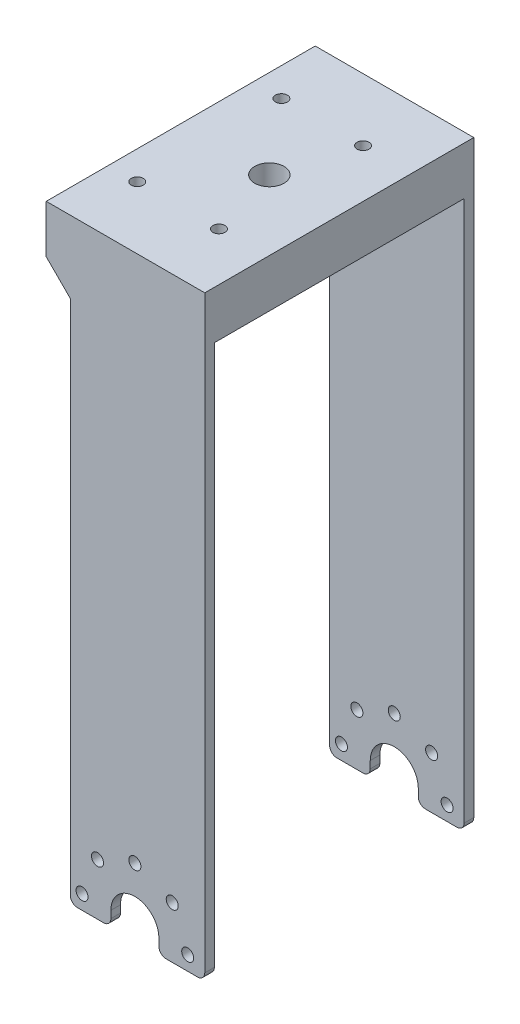
from build123d import *

# Parameters (mm, degrees)
SKETCH1_W               = 28
SKETCH1_H               = 124.1
BOSS_EXTRUDE1_DEPTH     = 2
CUT_EXTRUDE2_DEPTH      = 128.235254548
CUT_EXTRUDE2_DEPTH_BACK = 2
SKETCH4_R               = 1.25
CUT_EXTRUDE3_DEPTH      = 2
CIRPATTERN1_COUNT       = 5
CIRPATTERN1_ANGLE       = 180
FILLET1_R               = 1.5
SKETCH7_W               = 28
SKETCH7_H               = 124.1
BOSS_EXTRUDE2_DEPTH     = 2
CUT_EXTRUDE4_DEPTH      = 139.999316545
CUT_EXTRUDE4_DEPTH_BACK = 2
CUT_EXTRUDE5_START      = -2
SKETCH11_R              = 1.25
CUT_EXTRUDE5_DEPTH      = 2
CIRPATTERN2_COUNT       = 5
CIRPATTERN2_ANGLE       = 180
FILLET2_R               = 1.5
SKETCH17_W              = 33
SKETCH17_H              = 52
BOSS_EXTRUDE5_DEPTH     = 15
CUT_EXTRUDE7_REACH      = 140.999
SKETCH18_R              = 3.05
SKETCH19_R              = 1.25
CUT_EXTRUDE8_DEPTH      = 10
SKETCH20_W              = 29.100039055
SKETCH20_H              = 52
CUT_EXTRUDE9_DEPTH      = 5
SKETCH21_W              = 5
SKETCH21_H              = 15
BOSS_EXTRUDE6_DEPTH     = 2
SKETCH22_W              = 52
SKETCH22_H              = 5
CUT_EXTRUDE10_DEPTH     = 140.645667674
SKETCH23_W              = 52
SKETCH23_H              = 5
CUT_EXTRUDE11_DEPTH     = 140.645676357
CUT_EXTRUDE12_DEPTH     = 139.205680057
SKETCH25_R              = 2.5
CUT_EXTRUDE13_DEPTH     = 5


with BuildPart() as part:
    # Sketch1 → Boss-Extrude1 (new body)
    with BuildSketch(Plane.XY):
        with Locations((14, 62.05)):
            Rectangle(SKETCH1_W, SKETCH1_H)
    extrude(amount=-BOSS_EXTRUDE1_DEPTH)

    # Sketch3 → Cut-Extrude2 (cut, two sides: drawn at the far end of the back side and taken through both)
    with BuildSketch(Plane.XY.offset(-CUT_EXTRUDE2_DEPTH_BACK)):
        with BuildLine():
            Line((18.449960945, -261.260932316), (18.449960945, 0))
            Line((18.449960945, 0), (18.449960945, 3))
            ThreePointArc((18.449960945, 3), (13.449960945, 8), (8.449960945, 3))
            Line((8.449960945, 3), (8.449960945, 0))
            Line((8.449960945, 0), (8.449960945, -261.260932316))
            Line((8.449960945, -261.260932316), (8.449960945, -783.782796947))
            Line((8.449960945, -783.782796947), (18.449960945, -783.782796947))
            Line((18.449960945, -783.782796947), (18.449960945, -261.260932316))
        make_face()
    extrude(amount=CUT_EXTRUDE2_DEPTH + CUT_EXTRUDE2_DEPTH_BACK, mode=Mode.SUBTRACT)

    # Sketch4 → Cut-Extrude3 (cut)
    with BuildSketch(Plane.XY):
        with Locations((2.449960945, 3)):
            Circle(SKETCH4_R)
    cut_extrude3 = extrude(amount=-CUT_EXTRUDE3_DEPTH, mode=Mode.SUBTRACT)

    # CirPattern1: Cut-Extrude3 ×5 about axis
    cirpattern1_axis = Axis((13.449960945, 3, 0), (0, 0, -1))
    for i in range(1, CIRPATTERN1_COUNT):
        add(cut_extrude3.rotate(cirpattern1_axis, i * CIRPATTERN1_ANGLE / (CIRPATTERN1_COUNT - 1)), mode=Mode.SUBTRACT)

    # Fillet1
    fillet1_edges = [part.edges().sort_by_distance(p)[0] for p in [
        (28, 0, -1),
        (0, 0, -1),
        (18.449960945, 0, -1),
        (8.449960945, 0, -1),
    ]]
    fillet(fillet1_edges, radius=FILLET1_R)



with BuildPart() as body_2:
    # Sketch7 → Boss-Extrude2 (new body)
    with BuildSketch(Plane.XY.offset(-56)):
        with Locations((14, 62.05)):
            Rectangle(SKETCH7_W, SKETCH7_H)
    extrude(amount=BOSS_EXTRUDE2_DEPTH)

    # Sketch10 → Cut-Extrude4 (cut, two sides: drawn at the far end of the back side and taken through both)
    with BuildSketch(Plane(origin=(0, 0, -56), x_dir=(-1, 0, 0), z_dir=(0, 0, -1)).offset(-CUT_EXTRUDE4_DEPTH_BACK)):
        with BuildLine():
            Line((-8.449960945, -261.260932316), (-8.449960945, 0))
            Line((-8.449960945, 0), (-8.449960945, 3))
            ThreePointArc((-8.449960945, 3), (-13.449960945, 8), (-18.449960945, 3))
            Line((-18.449960945, 3), (-18.449960945, 0))
            Line((-18.449960945, 0), (-18.449960945, -261.260932316))
            Line((-18.449960945, -261.260932316), (-18.449960945, -783.782796947))
            Line((-18.449960945, -783.782796947), (-8.449960945, -783.782796947))
            Line((-8.449960945, -783.782796947), (-8.449960945, -261.260932316))
        make_face()
    extrude(amount=CUT_EXTRUDE4_DEPTH + CUT_EXTRUDE4_DEPTH_BACK, mode=Mode.SUBTRACT)

    # Sketch11 → Cut-Extrude5 (cut)
    with BuildSketch(Plane(origin=(0, 0, -56), x_dir=(-1, 0, 0), z_dir=(0, 0, -1)).offset(CUT_EXTRUDE5_START)):
        with Locations((-24.449960945, 3)):
            Circle(SKETCH11_R)
    cut_extrude5 = extrude(amount=CUT_EXTRUDE5_DEPTH, mode=Mode.SUBTRACT)

    # CirPattern2: Cut-Extrude5 ×5 about axis
    cirpattern2_axis = Axis((13.449960945, 3, 0), (0, 0, 1))
    for i in range(1, CIRPATTERN2_COUNT):
        add(cut_extrude5.rotate(cirpattern2_axis, i * CIRPATTERN2_ANGLE / (CIRPATTERN2_COUNT - 1)), mode=Mode.SUBTRACT)

    # Fillet2
    fillet2_edges = [body_2.edges().sort_by_distance(p)[0] for p in [
        (28, 0, -55),
        (0, 0, -55),
        (8.449960945, 0, -55),
        (18.449960945, 0, -55),
    ]]
    fillet(fillet2_edges, radius=FILLET2_R)


with BuildPart() as part_1:
    add(part.part)

    add(body_2.part)  # Boss-Extrude5 merges body 2
    # Sketch17 → Boss-Extrude5 (add)
    with BuildSketch(Plane(origin=(0, 124.1, 0), x_dir=(1, 0, 0), z_dir=(0, 1, 0))):
        with Locations((11.5, 28)):
            Rectangle(SKETCH17_W, SKETCH17_H)
    extrude(amount=-BOSS_EXTRUDE5_DEPTH)

    # Sketch18 → Cut-Extrude7 (cut, up to next)
    with BuildSketch(Plane(origin=(0, 124.1, 0), x_dir=(1, 0, 0), z_dir=(0, 1, 0)), mode=Mode.PRIVATE) as cut_extrude7_sk1:
        with Locations((13.449960945, 28)):
            Circle(SKETCH18_R)
    cut_extrude7_tool1 = extrude(cut_extrude7_sk1.sketch, amount=-CUT_EXTRUDE7_REACH, mode=Mode.PRIVATE) & part_1.part
    add(cut_extrude7_tool1.solids().sort_by_distance((13.449961, 124.1, -28))[0], mode=Mode.SUBTRACT)

    # Sketch19 → Cut-Extrude8 (cut)
    with BuildSketch(Plane(origin=(0, 124.1, 0), x_dir=(1, 0, 0), z_dir=(0, 1, 0))):
        with Locations((0.949960945, 43)):
            Circle(SKETCH19_R)
        with Locations((17.949960945, 43)):
            Circle(SKETCH19_R)
    cut_extrude8 = extrude(amount=-CUT_EXTRUDE8_DEPTH, mode=Mode.SUBTRACT)

    # Mirror9: Cut-Extrude8 across plane
    add(cut_extrude8.mirror(Plane(origin=(0, 0, -28), x_dir=(1, 0, 0), z_dir=(0, 0, -1))), mode=Mode.SUBTRACT)

    # Sketch20 → Cut-Extrude9 (cut)
    with BuildSketch(Plane.XZ.offset(-109.1)):
        with Locations((11.499980473, -28)):
            Rectangle(SKETCH20_W, SKETCH20_H)
    extrude(amount=-CUT_EXTRUDE9_DEPTH, mode=Mode.SUBTRACT)

    # Sketch21 → Boss-Extrude6 (add)
    with BuildSketch(Plane.XY.offset(-2)):
        with Locations((-2.5, 116.6)):
            Rectangle(SKETCH21_W, SKETCH21_H)
    boss_extrude6 = extrude(amount=BOSS_EXTRUDE6_DEPTH)

    # Mirror10: Boss-Extrude6 across plane
    add(boss_extrude6.mirror(Plane(origin=(0, 0, -28), x_dir=(1, 0, 0), z_dir=(0, 0, -1))))

    # Sketch22 → Cut-Extrude10 (cut, through all)
    with BuildSketch(Plane.ZY.offset(-26.05)):
        with Locations((-28, 111.6)):
            Rectangle(SKETCH22_W, SKETCH22_H)
    extrude(amount=-CUT_EXTRUDE10_DEPTH, mode=Mode.SUBTRACT)

    # Sketch23 → Cut-Extrude11 (cut, through all)
    with BuildSketch(Plane(origin=(-3.050039055, 0, 0), x_dir=(0, 0, -1), z_dir=(1, 0, 0))):
        with Locations((28, 111.6)):
            Rectangle(SKETCH23_W, SKETCH23_H)
    extrude(amount=-CUT_EXTRUDE11_DEPTH, mode=Mode.SUBTRACT)

    # Sketch24 → Cut-Extrude12 (cut, through all)
    with BuildSketch(Plane(origin=(0, 0, -2), x_dir=(-1, 0, 0), z_dir=(0, 0, -1))):
        Polygon((0, 109.1), (5, 114.1), (5, 109.1), align=None)
    cut_extrude12 = extrude(amount=-CUT_EXTRUDE12_DEPTH, mode=Mode.SUBTRACT)

    # Mirror11: Cut-Extrude12 across plane
    add(cut_extrude12.mirror(Plane(origin=(0, 0, -28), x_dir=(1, 0, 0), z_dir=(0, 0, -1))), mode=Mode.SUBTRACT)

    # Sketch25 → Cut-Extrude13 (cut)
    with BuildSketch(Plane.XZ.offset(-114.1)):
        with Locations((0.949960945, -43)):
            Circle(SKETCH25_R)
        with Locations((17.949960945, -43)):
            Circle(SKETCH25_R)
    cut_extrude13 = extrude(amount=-CUT_EXTRUDE13_DEPTH, mode=Mode.SUBTRACT)

    # Mirror12: Cut-Extrude13 across plane
    add(cut_extrude13.mirror(Plane(origin=(0, 0, -28), x_dir=(1, 0, 0), z_dir=(0, 0, -1))), mode=Mode.SUBTRACT)


solid = part_1.part
